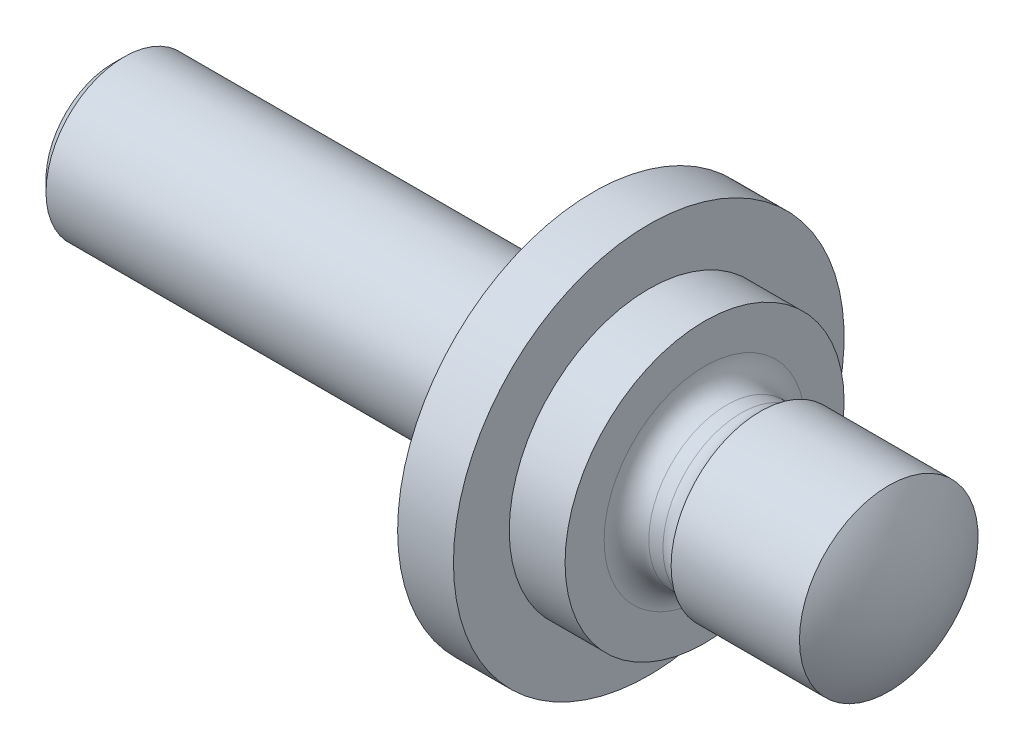
from build123d import *

# Parameters (mm, degrees)
RADYUS2_R = 2
PAH1_SIZE = 1
IZIM2_W   = 0.487804803
IZIM2_H   = 8


with BuildPart() as part:
    # Çizim1 → Döndür1 (revolve)
    with BuildSketch(Plane.XY, mode=Mode.PRIVATE) as d_nd_r1_sk:
        Polygon((0, 0), (0, 7), (43, 7), (43, 17.5), (48, 17.5), (48, 12.5), (53, 12.5), (53, 7), (58, 7), (58, 8), (72, 8), (72, 0), align=None)
    revolve(d_nd_r1_sk.sketch.rotate(Axis((0, 0, 0), (1, 0, 0)), 90), axis=Axis((0, 0, 0), (1, 0, 0)))

    # Radyus2
    # the kernel refuses this fillet: 2 mm, written as the material it adds along each edge
    with BuildSketch(Plane(origin=(58, 0, 0), x_dir=(0, 0, 1), z_dir=(0, 1, 0))) as radyus2_piece_1:
        with BuildLine():
            CenterArc((9, -1.732050808), RADYUS2_R, 120, 60)
            Line((8, 0), (7.98, 0.034641016))
            ThreePointArc((7.98, 0.034641016), (7.5, 0.04), (7, 0.04))
            Line((7, 0.04), (6.96, 0))
            Line((6.96, 0), (6.96, -1.732050808))
            Line((6.96, -1.732050808), (7, -1.732050808))
        make_face()
    revolve(axis=Axis((58, 0, 0), (1, 0, 0)))
    with BuildSketch(Plane(origin=(53, 0, 0), x_dir=(0, 0, 1), z_dir=(0, 1, 0))) as radyus2_piece_2:
        with BuildLine():
            CenterArc((7 + RADYUS2_R, RADYUS2_R), RADYUS2_R, 180, 90)
            Line((7, RADYUS2_R), (7 - RADYUS2_R * 0.02, RADYUS2_R))
            Line((7 - RADYUS2_R * 0.02, RADYUS2_R), (7 - RADYUS2_R * 0.02, -RADYUS2_R * 0.02))
            Line((7 - RADYUS2_R * 0.02, -RADYUS2_R * 0.02), (7 + RADYUS2_R, -RADYUS2_R * 0.02))
            Line((7 + RADYUS2_R, -RADYUS2_R * 0.02), (7 + RADYUS2_R, 0))
        make_face()
    revolve(axis=Axis((53, 0, 0), (1, 0, 0)))

    # Pah1
    pah1_edges = [part.edges().sort_by_distance(p)[0] for p in [
        (0, 0, -7),
    ]]
    chamfer(pah1_edges, length=PAH1_SIZE)

    # Çizim2 → Kes-Döndür1 (revolve, cut)
    with BuildSketch(Plane.XY):
        with BuildLine():
            Line((69.5, 8), (72, 8))
            Line((72, 8), (72, 0))
            ThreePointArc((72, 0), (71.360443691, 4.190763654), (69.5, 8))
        make_face()
        with Locations((72.243902402, 4)):
            Rectangle(IZIM2_W, IZIM2_H)
    revolve(axis=Axis((72, 0, 0), (-1, 0, 0)), mode=Mode.SUBTRACT)


solid = part.part
